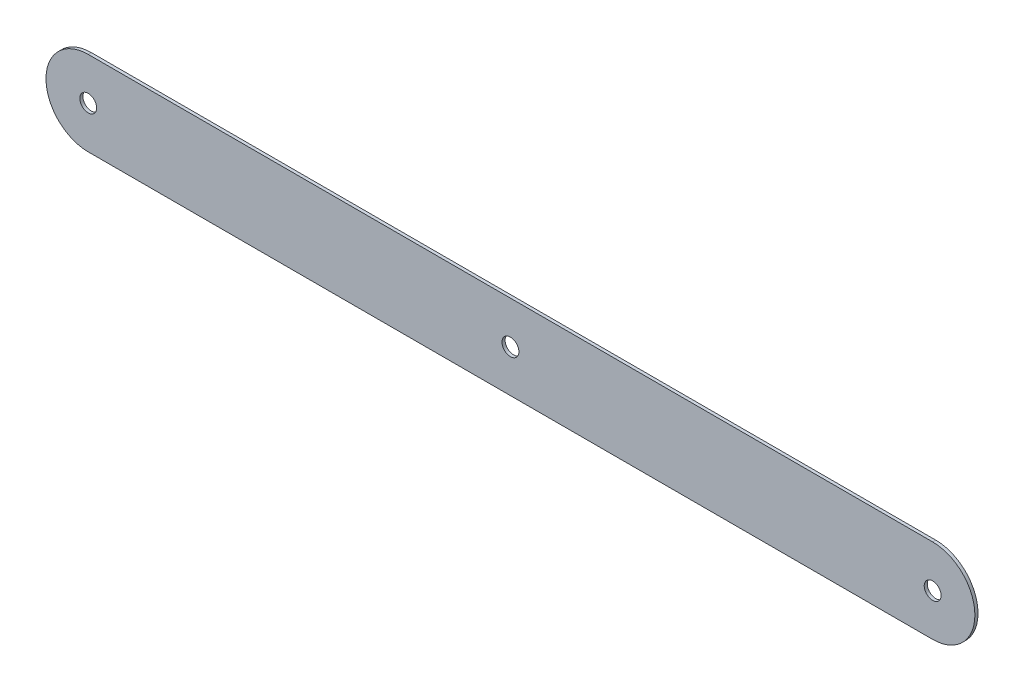
from build123d import *

# Parameters (mm, degrees)
SKETCH1_R          = 2
BASE_FLANGE1_DEPTH = 0.7366


# Sheet-metal steps are written as plain solids
with BuildPart() as part:
    # Sketch1 → Base-Flange1 (new body)
    with BuildSketch(Plane.XY):
        with BuildLine():
            Line((-28.344481605, 10), (171.655518395, 10))
            ThreePointArc((171.655518395, 10), (181.655518395, 0), (171.655518395, -10))
            Line((171.655518395, -10), (-28.344481605, -10))
            ThreePointArc((-28.344481605, -10), (-38.344481605, 0), (-28.344481605, 10))
        make_face()
        with Locations((-28.344481605, 0)):
            Circle(SKETCH1_R, mode=Mode.SUBTRACT)
        with Locations((171.655518395, 0)):
            Circle(SKETCH1_R, mode=Mode.SUBTRACT)
        with Locations((71.655518395, 0)):
            Circle(SKETCH1_R, mode=Mode.SUBTRACT)
    extrude(amount=-BASE_FLANGE1_DEPTH)


solid = part.part
